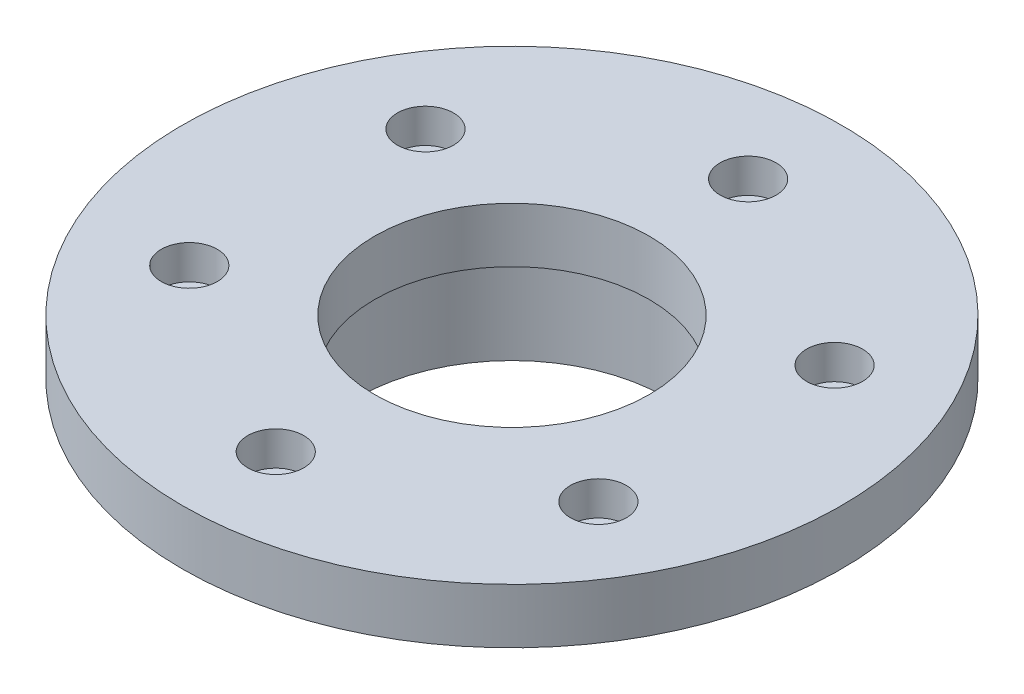
from build123d import *

# Parameters (mm, degrees)
SKETCH1_R           = 30
BOSS_EXTRUDE1_DEPTH = 5
SKETCH2_R           = 2.55
CUT_EXTRUDE1_DEPTH  = 3.1
SKETCH3_R           = 16
SKETCH3_R_2         = 14.05
BOSS_EXTRUDE2_DEPTH = 8.5
SKETCH4_R           = 12.5
CUT_EXTRUDE2_DEPTH  = 8.5


with BuildPart() as part:
    # Sketch1 → Boss-Extrude1 (new body)
    with BuildSketch(Plane(origin=(0, 0, 0), x_dir=(1, 0, 0), z_dir=(0, 1, 0))):
        Circle(SKETCH1_R)
    extrude(amount=BOSS_EXTRUDE1_DEPTH)

    # Sketch2 → Cut-Extrude1 (cut)
    with BuildSketch(Plane(origin=(0, 5, 0), x_dir=(1, 0, 0), z_dir=(0, 1, 0))):
        with Locations((0, 21.5)):
            Circle(SKETCH2_R)
        with Locations((18.619546181, 10.75)):
            Circle(SKETCH2_R)
        with Locations((18.619546181, -10.75)):
            Circle(SKETCH2_R)
        with Locations((0, -21.5)):
            Circle(SKETCH2_R)
        with Locations((-18.619546181, -10.75)):
            Circle(SKETCH2_R)
        with Locations((-18.619546181, 10.75)):
            Circle(SKETCH2_R)
    extrude(amount=-CUT_EXTRUDE1_DEPTH, mode=Mode.SUBTRACT)

    # Sketch3 → Boss-Extrude2 (add)
    with BuildSketch(Plane.XZ):
        Circle(SKETCH3_R)
        Circle(SKETCH3_R_2, mode=Mode.SUBTRACT)
    extrude(amount=BOSS_EXTRUDE2_DEPTH)

    # Sketch4 → Cut-Extrude2 (cut)
    with BuildSketch(Plane(origin=(0, 5, 0), x_dir=(1, 0, 0), z_dir=(0, 1, 0))):
        Circle(SKETCH4_R)
    extrude(amount=-CUT_EXTRUDE2_DEPTH, mode=Mode.SUBTRACT)


solid = part.part
